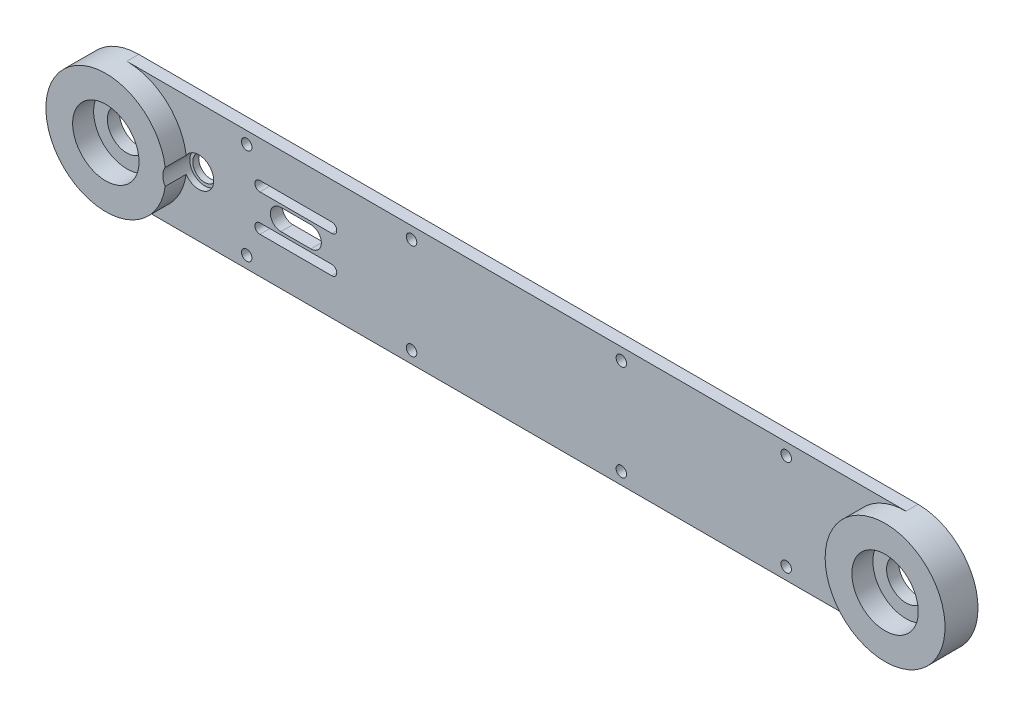
from build123d import *

# Parameters (mm, degrees)
AUFSATZ_LINEAR_AUSTRAGEN1_DEPTH      = 4
SKIZZE2_R                            = 20
SKIZZE2_R_2                          = 11.075
AUFSATZ_LINEAR_AUSTRAGEN2_DEPTH      = 7
SKIZZE3_R                            = 6.5
SCHNITT_LINEAR_AUSTRAGEN1_DEPTH      = 152.489273548
SKIZZE4_R                            = 1.75
SCHNITT_LINEAR_AUSTRAGEN2_DEPTH      = 152.489273548
SKIZZE5_R                            = 4
SCHNITT_LINEAR_AUSTRAGEN3_DEPTH      = 152.726728034
SCHNITT_LINEAR_AUSTRAGEN4_DEPTH      = 152.489273548
SCHNITT_LINEAR_AUSTRAGEN4_DEPTH_BACK = 2
SKIZZE6_R                            = 5
SCHNITT_LINEAR_AUSTRAGEN5_DEPTH      = 152.726728034


with BuildPart() as part:
    # Skizze1 → Aufsatz-Linear austragen1 (new body)
    with BuildSketch(Plane.XY):
        with BuildLine():
            Line((-130, -20), (130, -20))
            ThreePointArc((130, -20), (150, 0), (130, 20))
            Line((130, 20), (-130, 20))
            ThreePointArc((-130, 20), (-150, 0), (-130, -20))
        make_face()
    extrude(amount=AUFSATZ_LINEAR_AUSTRAGEN1_DEPTH)

    # Skizze2 → Aufsatz-Linear austragen2 (add)
    with BuildSketch(Plane.XY.offset(4)):
        with Locations((-130, 0)):
            Circle(SKIZZE2_R)
        with Locations((-130, 0)):
            Circle(SKIZZE2_R_2, mode=Mode.SUBTRACT)
    aufsatz_linear_austragen2 = extrude(amount=AUFSATZ_LINEAR_AUSTRAGEN2_DEPTH)

    # Skizze3 → Schnitt-Linear austragen1 (cut, symmetric)
    with BuildSketch(Plane.XY.offset(4)):
        with Locations((-130, 0)):
            Circle(SKIZZE3_R)
    schnitt_linear_austragen1 = extrude(amount=SCHNITT_LINEAR_AUSTRAGEN1_DEPTH, both=True, mode=Mode.SUBTRACT)

    # Spiegeln1: Aufsatz-Linear austragen2, Schnitt-Linear austragen1 across plane
    add(aufsatz_linear_austragen2.mirror(Plane(origin=(0, 0, 0), x_dir=(0, 0, 1), z_dir=(1, 0, 0))))
    add(schnitt_linear_austragen1.mirror(Plane(origin=(0, 0, 0), x_dir=(0, 0, 1), z_dir=(1, 0, 0))), mode=Mode.SUBTRACT)

    # Skizze4 → Schnitt-Linear austragen2 (cut, through all)
    with BuildSketch(Plane.XY.offset(4)):
        with Locations((-90, 16)):
            Circle(SKIZZE4_R)
        with Locations((-90, -16)):
            Circle(SKIZZE4_R)
        with Locations((90, -16)):
            Circle(SKIZZE4_R)
        with Locations((90, 16)):
            Circle(SKIZZE4_R)
        with Locations((-35, 16)):
            Circle(SKIZZE4_R)
        with Locations((-35, -16)):
            Circle(SKIZZE4_R)
        with Locations((35, -16)):
            Circle(SKIZZE4_R)
        with Locations((35, 16)):
            Circle(SKIZZE4_R)
    extrude(amount=-SCHNITT_LINEAR_AUSTRAGEN2_DEPTH, mode=Mode.SUBTRACT)

    # Skizze5 → Schnitt-Linear austragen3 (cut, through all)
    with BuildSketch(Plane(origin=(0, 0, 0), x_dir=(-1, 0, 0), z_dir=(0, 0, -1))):
        with Locations((106, 0)):
            Circle(SKIZZE5_R)
    extrude(amount=-SCHNITT_LINEAR_AUSTRAGEN3_DEPTH, mode=Mode.SUBTRACT)

    # Skizze6 → Schnitt-Linear austragen4 (cut, two sides: drawn at the far end of the back side and taken through both)
    with BuildSketch(Plane.XY.offset(4).offset(-SCHNITT_LINEAR_AUSTRAGEN4_DEPTH_BACK)):
        with Locations((-106, 0)):
            Circle(SKIZZE6_R)
    extrude(amount=SCHNITT_LINEAR_AUSTRAGEN4_DEPTH + SCHNITT_LINEAR_AUSTRAGEN4_DEPTH_BACK, mode=Mode.SUBTRACT)

    # Skizze7 → Schnitt-Linear austragen5 (cut, through all)
    with BuildSketch(Plane(origin=(0, 0, 0), x_dir=(-1, 0, 0), z_dir=(0, 0, -1))):
        with BuildLine():
            Line((68.6, 3.5), (78.6, 3.5))
            ThreePointArc((78.6, 3.5), (82.1, 0), (78.6, -3.5))
            Line((78.6, -3.5), (68.6, -3.5))
            ThreePointArc((68.6, -3.5), (65.1, 0), (68.6, 3.5))
        make_face()
        with BuildLine():
            Line((61.6, 7.77), (85.6, 7.77))
            ThreePointArc((85.6, 7.77), (87.25, 6.12), (85.6, 4.47))
            Line((85.6, 4.47), (61.6, 4.47))
            ThreePointArc((61.6, 4.47), (59.95, 6.12), (61.6, 7.77))
        make_face()
        with BuildLine():
            Line((61.6, -7.77), (85.6, -7.77))
            ThreePointArc((85.6, -7.77), (87.25, -6.12), (85.6, -4.47))
            Line((85.6, -4.47), (61.6, -4.47))
            ThreePointArc((61.6, -4.47), (59.95, -6.12), (61.6, -7.77))
        make_face()
    extrude(amount=-SCHNITT_LINEAR_AUSTRAGEN5_DEPTH, mode=Mode.SUBTRACT)


solid = part.part
